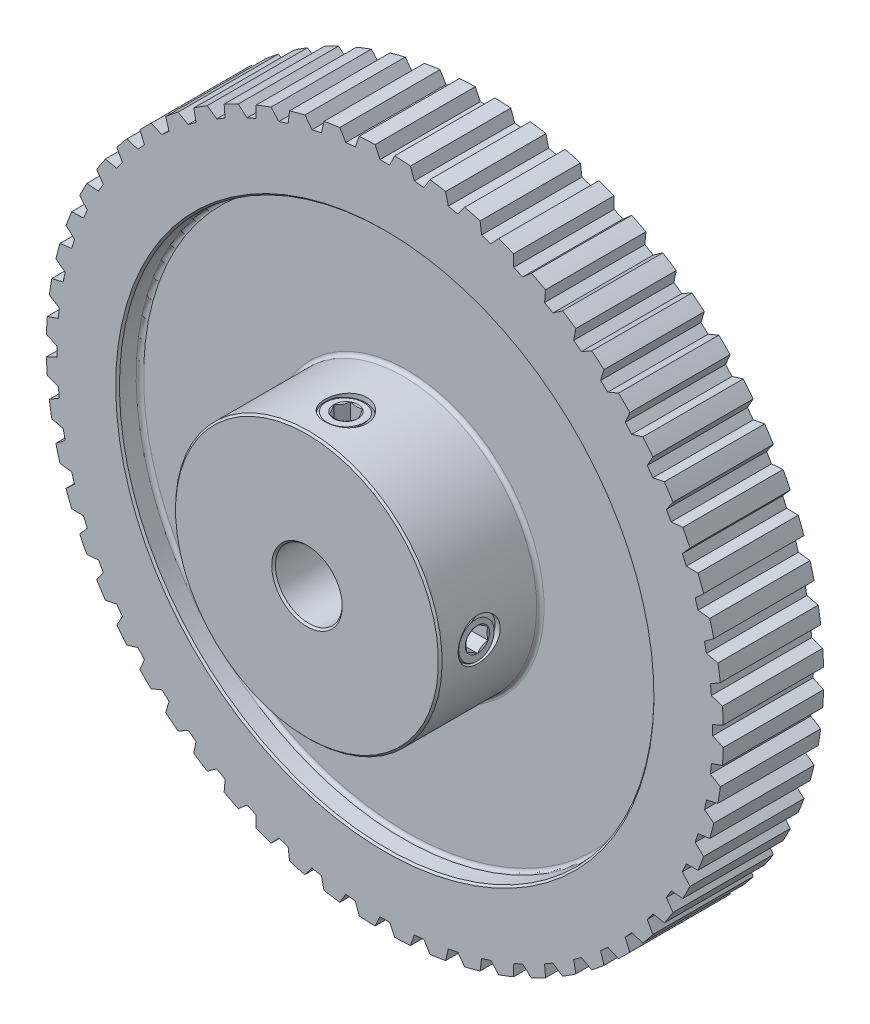
from build123d import *

# Parameters (mm, degrees)
CUT_EXTRUDE1_DEPTH = 70.731952504
CIRPATTERN1_COUNT  = 60
SKETCH5_R          = 3
CUT_EXTRUDE2_DEPTH = 70.704168357
SKETCH6_R          = 3
CUT_EXTRUDE3_DEPTH = 70.704168378
CUT_EXTRUDE4_DEPTH = 3
CIRPATTERN2_COUNT  = 2
CIRPATTERN2_ANGLE  = 90
CHAMFER1_SIZE      = 0.264
FILLET1_R          = 0.528
CUT_SWEEP1_PITCH   = 1
CIRPATTERN3_COUNT  = 2
CIRPATTERN3_ANGLE  = 90


with BuildPart() as part:
    # Sketch3 → Revolve1 (revolve)
    with BuildSketch(Plane(origin=(0, 0, 0), x_dir=(0, 0, -1), z_dir=(1, 0, 0)), mode=Mode.PRIVATE) as revolve1_sk:
        Polygon((-11.1, 4.7625), (14.3, 4.7625), (14.3, 19), (11.125, 19), (11.125, 38.1), (14.3, 38.1), (14.3, 48.26), (0, 48.26), (0, 38.1), (3.175, 38.1), (3.175, 19), (-11.1, 19), align=None)
    revolve(revolve1_sk.sketch.rotate(Axis((0, 0, 11.1), (0, 0, -1)), 180), axis=Axis((0, 0, 11.1), (0, 0, -1)))

    # Sketch4 → Cut-Extrude1 (cut, through all)
    with BuildSketch(Plane.XY):
        with BuildLine():
            Line((-0.690489274, 46.736), (0.690489274, 46.736))
            Line((0.690489274, 46.736), (2.093074496, 49.743853714))
            ThreePointArc((2.093074496, 49.743853714), (0, 49.787869438), (-2.093074496, 49.743853714))
            Line((-2.093074496, 49.743853714), (-0.690489274, 46.736))
        make_face()
    cut_extrude1 = extrude(amount=-CUT_EXTRUDE1_DEPTH, mode=Mode.SUBTRACT)

    # CirPattern1: Cut-Extrude1 ×60 about axis
    cirpattern1_axis = Axis((0, 0, 0), (0, 0, 1))
    for i in range(1, CIRPATTERN1_COUNT):
        add(cut_extrude1.rotate(cirpattern1_axis, i * 360 / CIRPATTERN1_COUNT), mode=Mode.SUBTRACT)

    # Sketch5 → Cut-Extrude2 (cut, through all)
    with BuildSketch(Plane(origin=(0, 0, 0), x_dir=(0, 0, -1), z_dir=(0, 1, 0))):
        with Locations((-5.55, 0)):
            Circle(SKETCH5_R)
    extrude(amount=CUT_EXTRUDE2_DEPTH, mode=Mode.SUBTRACT)

    # Sketch6 → Cut-Extrude3 (cut, through all)
    with BuildSketch(Plane(origin=(0, 0, 0), x_dir=(0, 0, -1), z_dir=(1, 0, 0))):
        with Locations(Location((-5.55, 0, 0), (0, 0, 180))):
            Circle(SKETCH6_R)
    extrude(amount=CUT_EXTRUDE3_DEPTH, mode=Mode.SUBTRACT)

    # Chamfer1
    chamfer1_edges = [part.edges().sort_by_distance(p)[0] for p in [
        (0, 38.1, -14.3),
        (0, 38.1, 0),
        (0, 19, 11.1),
        (0, 4.7625, 11.1),
        (0, 4.7625, -14.3),
        (0, 19, -14.3),
    ]]
    chamfer(chamfer1_edges, length=CHAMFER1_SIZE)

    # Fillet1
    fillet1_edges = [part.edges().sort_by_distance(p)[0] for p in [
        (0, 38.1, -11.125),
        (0, 38.1, -3.175),
        (0, 19, -3.175),
        (0, 19, -11.125),
    ]]
    fillet(fillet1_edges, radius=FILLET1_R)


with BuildPart() as body_2:
    # Sketch7 → Revolve2 (revolve)
    with BuildSketch(Plane(origin=(0, 0, 5.55), x_dir=(0, 0, 1), z_dir=(-1, 0, 0)), mode=Mode.PRIVATE) as revolve2_sk:
        Polygon((-3, 18.42), (-3, 5.0925), (-2.67, 4.7625), (0, 4.7625), (0, 18.75), (-2.67, 18.75), align=None)
    revolve(revolve2_sk.sketch.rotate(Axis((0, 19, 5.55), (0, -1, 0)), 180), axis=Axis((0, 19, 5.55), (0, -1, 0)))

    # Sketch8 → Cut-Extrude4 (cut)
    with BuildSketch(Plane.ZX.offset(18.75)):
        Polygon((5.55, 1.732050808), (4.05, 0.866025404), (4.05, -0.866025404), (5.55, -1.732050808), (7.05, -0.866025404), (7.05, 0.866025404), align=None)
    extrude(amount=-CUT_EXTRUDE4_DEPTH, mode=Mode.SUBTRACT)

    # Cut-Extrude5 cone 1 section (through the dimple's axis) → Cut-Extrude5 (revolve, cut)
    with BuildSketch(Plane(origin=(0, 18.75, 5.55), x_dir=(0, 0, 1), z_dir=(1, 0, 0))):
        Polygon((0, 0), (1.732050808, 0), (0, 1), align=None)
    revolve(axis=Axis((0, 18.75, 5.55), (0, -1, 0)), mode=Mode.SUBTRACT)


with BuildPart() as cirpattern2_1:
    # CirPattern2: pattern copy
    add(body_2.part.rotate(Axis((0, 0, 0), (0, 0, -1)), 1 * CIRPATTERN2_ANGLE / (CIRPATTERN2_COUNT - 1)))


with BuildPart() as body_2_1:
    add(body_2.part)

    # Cut-Sweep1: the profile of Sketch11 screwed along a right-hand helix of 14.807 turns, 8 arcs to a turn; built about Z, then put on its axis
    cut_sweep1_z = Axis((0, 0, 0), (0, 0, 1))
    cut_sweep1_corners = [(3.054126588, 0, -0.90625), (3.054126588, 0, 0.03125), (2.350480947, 0, -0.375), (2.350480947, 0, -0.5)]
    with BuildLine(mode=Mode.PRIVATE) as cut_sweep1_profile:
        Line(cut_sweep1_corners[0], cut_sweep1_corners[1])
        Line(cut_sweep1_corners[1], cut_sweep1_corners[2])
        Line(cut_sweep1_corners[2], cut_sweep1_corners[3])
        Line(cut_sweep1_corners[3], cut_sweep1_corners[0])
    cut_sweep1_cap = Face(cut_sweep1_profile.wire())
    cut_sweep1_turn_angles = [0, 22.5, 45, 67.5, 90, 112.5, 135, 157.5, 180, 202.5, 225, 247.5, 270, 292.5, 315, 337.5, 360]
    cut_sweep1_turn_weights = [1, 0.9238795325112867, 1, 0.9238795325112867, 1, 0.9238795325112867, 1, 0.9238795325112867, 1, 0.9238795325112867, 1, 0.9238795325112867, 1, 0.9238795325112867, 1, 0.9238795325112867, 1]
    cut_sweep1_turn_rails = [Edge.make_bspline([Vector(p[0], p[1], 0).rotate(cut_sweep1_z, cut_sweep1_turn_angles[k]) / cut_sweep1_turn_weights[k] + Vector(0, 0, p[2] + CUT_SWEEP1_PITCH * cut_sweep1_turn_angles[k] / 360) for k in range(17)], [0, 0, 0, 1, 1, 2, 2, 3, 3, 4, 4, 5, 5, 6, 6, 7, 7, 8, 8, 8], 2, cut_sweep1_turn_weights) for p in cut_sweep1_corners]
    cut_sweep1_turn_sides = [Face.make_surface_from_curves(cut_sweep1_turn_rails[p[0]], cut_sweep1_turn_rails[p[1]]) for p in [(0, 1), (1, 2), (2, 3), (3, 0)]]
    cut_sweep1_last_angles = [5040, 5062.5, 5085, 5107.5, 5130, 5152.5, 5175, 5197.5, 5220, 5242.5, 5265, 5287.5, 5310, 5320.26, 5330.52]
    cut_sweep1_last_weights = [1, 0.9238795325112867, 1, 0.9238795325112867, 1, 0.9238795325112867, 1, 0.9238795325112867, 1, 0.9238795325112867, 1, 0.9238795325112867, 1, 0.9840096256511193, 1]
    cut_sweep1_last_rails = [Edge.make_bspline([Vector(p[0], p[1], 0).rotate(cut_sweep1_z, cut_sweep1_last_angles[k]) / cut_sweep1_last_weights[k] + Vector(0, 0, p[2] + CUT_SWEEP1_PITCH * cut_sweep1_last_angles[k] / 360) for k in range(15)], [0, 0, 0, 1, 1, 2, 2, 3, 3, 4, 4, 5, 5, 6, 6, 7, 7, 7], 2, cut_sweep1_last_weights) for p in cut_sweep1_corners]
    cut_sweep1_last_sides = [Face.make_surface_from_curves(cut_sweep1_last_rails[p[0]], cut_sweep1_last_rails[p[1]]) for p in [(0, 1), (1, 2), (2, 3), (3, 0)]]
    cut_sweep1 = Plane(origin=(0, 18.75, 5.55), x_dir=(0, 0, 1), z_dir=(0, -1, 0)) * Solid(Shell([*[p.moved(Location((0, 0, CUT_SWEEP1_PITCH * i))) for i in range(14) for p in cut_sweep1_turn_sides], *cut_sweep1_last_sides, cut_sweep1_cap, cut_sweep1_cap.rotate(cut_sweep1_z, 5330.52).moved(Location((0, 0, CUT_SWEEP1_PITCH * 5330.52 / 360)))]))
    add(cut_sweep1, mode=Mode.SUBTRACT)


with BuildPart() as cirpattern3_1:
    # CirPattern3: pattern copy
    add(body_2_1.part.rotate(Axis((0, 0, 11.1), (0, 0, -1)), 1 * CIRPATTERN3_ANGLE / (CIRPATTERN3_COUNT - 1)))


solid = Compound([part.part, body_2_1.part, cirpattern3_1.part])
